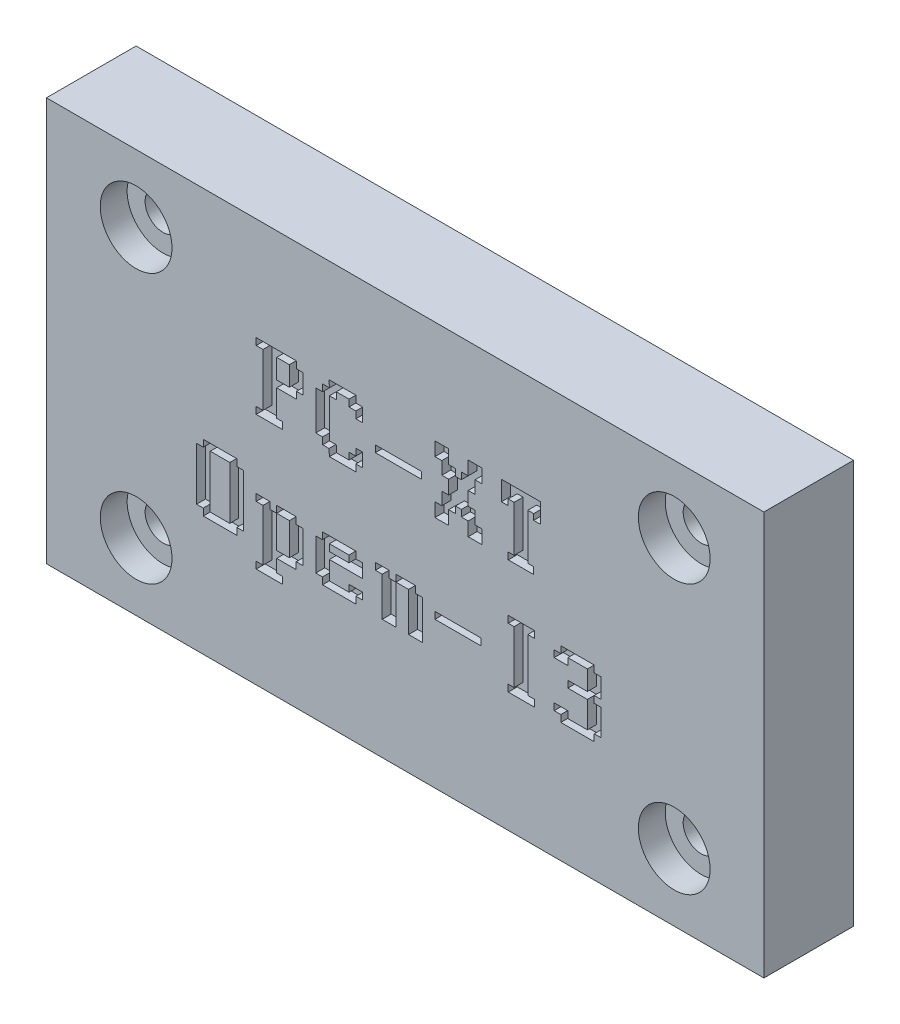
from build123d import *

# Parameters (mm, degrees)
SKETCH1_W                = 80
SKETCH1_H                = 45
BOSS_EXTRUDE1_DEPTH      = 10
SKETCH2_W                = 7.8
SKETCH2_H                = 12
CUT_EXTRUDE1_DEPTH       = 77
SKETCH3_R                = 2
CUT_EXTRUDE2_DEPTH       = 93.330926563
SKETCH4_R                = 4
CUT_EXTRUDE4_DEPTH       = 3
CUT_EXTRUDE5_START       = -1
CUT_EXTRUDE5_OUTLINE_W   = 1.41629902
CUT_EXTRUDE5_OUTLINE_H   = 2.178921569
CUT_EXTRUDE5_OUTLINE_W_2 = 2.178921569
CUT_EXTRUDE5_OUTLINE_H_2 = 5.883088235
CUT_EXTRUDE5_OUTLINE_W_3 = 5.147702206
CUT_EXTRUDE5_OUTLINE_H_3 = 0.762622549
CUT_EXTRUDE5_OUTLINE_W_4 = 2.178921568
CUT_EXTRUDE5_DEPTH       = 1


# Read off the part's stored shape, not the designer's step: Cut-Extrude5
with BuildPart() as part:
    # Sketch1 → Boss-Extrude1 (new body)
    with BuildSketch(Plane.XY):
        with Locations((40, 22.5)):
            Rectangle(SKETCH1_W, SKETCH1_H)
    extrude(amount=BOSS_EXTRUDE1_DEPTH)

    # Sketch2 → Cut-Extrude1 (cut)
    with BuildSketch(Plane.ZY):
        with Locations((3.9, 22.5)):
            Rectangle(SKETCH2_W, SKETCH2_H)
    extrude(amount=-CUT_EXTRUDE1_DEPTH, mode=Mode.SUBTRACT)

    # Sketch3 → Cut-Extrude2 (cut, through all)
    with BuildSketch(Plane.XY.offset(10)):
        with Locations((10, 37.5)):
            Circle(SKETCH3_R)
        with Locations((70, 37.5)):
            Circle(SKETCH3_R)
        with Locations((70, 7.5)):
            Circle(SKETCH3_R)
        with Locations((10, 7.5)):
            Circle(SKETCH3_R)
    extrude(amount=-CUT_EXTRUDE2_DEPTH, mode=Mode.SUBTRACT)

    # Sketch4 → Cut-Extrude4 (cut)
    with BuildSketch(Plane.XY.offset(10)):
        with Locations((10, 37.5)):
            Circle(SKETCH4_R)
        with Locations((70, 37.5)):
            Circle(SKETCH4_R)
        with Locations((70, 7.5)):
            Circle(SKETCH4_R)
        with Locations((10, 7.5)):
            Circle(SKETCH4_R)
    extrude(amount=-CUT_EXTRUDE4_DEPTH, mode=Mode.SUBTRACT)

    # Cut-Extrude5 outline → Cut-Extrude5 (cut)
    # profile 1 of 13: a face of its own
    with BuildSketch(Plane.XY.offset(10).offset(CUT_EXTRUDE5_START)):
        Polygon((25.673590686, 26.886952343), (25.673590686, 29.828496461), (27.879748775, 29.828496461), (27.879748775, 30.59111901), (28.615134804, 30.59111901), (28.615134804, 32.770040579), (27.867832797, 32.770040579), (27.867832797, 33.532663128), (23.385723039, 33.532663128), (23.385723039, 32.770040579), (24.148345588, 32.770040579), (24.148345588, 26.886952343), (23.385723039, 26.886952343), (23.385723039, 26.124329794), (26.327267157, 26.124329794), (26.327267157, 26.886952343), align=None)
        with Locations((26.381740196, 31.680579795)):
            Rectangle(CUT_EXTRUDE5_OUTLINE_W, CUT_EXTRUDE5_OUTLINE_H, mode=Mode.SUBTRACT)
    # profile 2 of 13: a face of its own
    with BuildSketch(Plane.XY.offset(10).offset(CUT_EXTRUDE5_START)):
        Polygon((25.673590686, 11.941854304), (25.673590686, 13.358153324), (27.852512255, 13.358153324), (27.852512255, 14.120775873), (28.615134804, 14.120775873), (28.615134804, 17.715996461), (27.852512255, 17.715996461), (27.852512255, 18.47861901), (25.673590686, 18.47861901), (25.673590686, 17.715996461), (27.089889706, 17.715996461), (27.089889706, 14.120775873), (25.673590686, 14.120775873), (25.673590686, 17.710889614), (25.668483839, 17.715996461), (24.910968137, 17.715996461), (24.910968137, 18.47861901), (23.385723039, 18.47861901), (23.385723039, 17.715996461), (24.148345588, 17.715996461), (24.148345588, 11.941854304), (23.385723039, 11.941854304), (23.385723039, 11.179231755), (26.327267157, 11.179231755), (26.327267157, 11.941854304), align=None)
    # profile 3 of 13: a face of its own
    with BuildSketch(Plane.XY.offset(10).offset(CUT_EXTRUDE5_START)):
        Polygon((52.147487745, 26.886952343), (51.493811275, 26.886952343), (51.493811275, 26.124329794), (54.326409314, 26.124329794), (54.326409314, 26.886952343), (53.672732843, 26.886952343), (53.672732843, 32.00741803), (54.326409314, 32.00741803), (54.326409314, 31.353741559), (55.089031863, 31.353741559), (55.089031863, 33.532663128), (50.731188725, 33.532663128), (50.731188725, 31.353741559), (51.493811275, 31.353741559), (51.493811275, 32.00741803), (52.147487745, 32.00741803), align=None)
    # profile 4 of 13: a face of its own
    with BuildSketch(Plane.XY.offset(10).offset(CUT_EXTRUDE5_START)):
        Polygon((33.73560049, 26.886952343), (32.319301471, 26.886952343), (32.319301471, 27.649574892), (31.556678922, 27.649574892), (31.556678922, 32.00741803), (32.319301471, 32.00741803), (32.319301471, 32.770040579), (33.73560049, 32.770040579), (33.73560049, 32.00741803), (34.498223039, 32.00741803), (34.498223039, 31.244795481), (35.260845588, 31.244795481), (35.260845588, 32.770040579), (34.498223039, 32.770040579), (34.498223039, 33.532663128), (31.502205882, 33.532663128), (31.556678922, 32.770040579), (30.794056373, 32.770040579), (30.794056373, 32.00741803), (30.031433824, 32.00741803), (30.031433824, 27.649574892), (30.794056373, 27.649574892), (30.794056373, 26.886952343), (31.502205882, 26.886952343), (31.556678922, 26.124329794), (34.498223039, 26.124329794), (34.498223039, 26.886952343), (35.260845588, 26.886952343), (35.260845588, 28.412197441), (34.498223039, 28.412197441), (34.498223039, 27.649574892), (33.73560049, 27.649574892), align=None)
    # profile 5 of 13: a face of its own
    with BuildSketch(Plane.XY.offset(10).offset(CUT_EXTRUDE5_START)):
        Polygon((47.027022059, 26.124329794), (48.552267157, 26.124329794), (48.552267157, 27.649574892), (47.789644608, 27.649574892), (47.789644608, 29.065873912), (47.027022059, 29.065873912), (47.027022059, 30.59111901), (47.789644608, 30.59111901), (47.789644608, 32.00741803), (48.552267157, 32.00741803), (48.552267157, 33.532663128), (47.027022059, 33.532663128), (47.027022059, 32.00741803), (46.26439951, 32.00741803), (46.26439951, 31.244795481), (45.610723039, 31.244795481), (45.610723039, 32.00741803), (44.84810049, 32.00741803), (44.84810049, 33.532663128), (43.322855392, 33.532663128), (43.322855392, 32.00741803), (44.085477941, 32.00741803), (44.085477941, 30.59111901), (44.84810049, 30.59111901), (44.84810049, 29.065873912), (44.085477941, 29.065873912), (44.085477941, 27.649574892), (43.322855392, 27.649574892), (43.322855392, 26.124329794), (44.84810049, 26.124329794), (44.84810049, 27.649574892), (45.610723039, 27.649574892), (45.610723039, 28.384960922), (46.26439951, 28.384960922), (46.26439951, 27.649574892), (47.027022059, 27.649574892), align=None)
    # profile 6 of 13: a face of its own
    with BuildSketch(Plane.XY.offset(10).offset(CUT_EXTRUDE5_START)):
        Polygon((58.139522059, 17.82494254), (58.139522059, 17.06231999), (60.318443627, 17.06231999), (60.318443627, 14.120775873), (58.139522059, 14.120775873), (58.139522059, 14.883398422), (56.614276961, 14.883398422), (56.614276961, 14.120775873), (57.358174403, 14.120775873), (57.358174403, 13.358153324), (61.081066176, 13.358153324), (61.081066176, 14.120775873), (61.843688725, 14.120775873), (61.843688725, 17.06231999), (61.081066176, 17.06231999), (61.081066176, 17.82494254), (61.843688725, 17.82494254), (61.843688725, 20.003864108), (61.081066176, 20.003864108), (61.081066176, 20.766486657), (57.358174403, 20.766486657), (57.358174403, 20.003864108), (56.614276961, 20.003864108), (56.614276961, 19.241241559), (58.139522059, 19.241241559), (58.139522059, 20.003864108), (60.318443627, 20.003864108), (60.318443627, 17.82494254), align=None)
    # profile 7 of 13: a face of its own
    with BuildSketch(Plane.XY.offset(10).offset(CUT_EXTRUDE5_START)):
        Polygon((53.672732843, 20.003864108), (54.435355392, 20.003864108), (54.435355392, 20.766486657), (51.493811275, 20.766486657), (51.493811275, 20.003864108), (52.147487745, 20.003864108), (52.147487745, 14.120775873), (51.493811275, 14.120775873), (51.493811275, 13.358153324), (54.435355392, 13.358153324), (54.435355392, 14.120775873), (53.672732843, 14.120775873), align=None)
    # profile 8 of 13: a face of its own
    with BuildSketch(Plane.XY.offset(10).offset(CUT_EXTRUDE5_START)):
        Polygon((17.487314262, 20.003864108), (16.740012255, 20.003864108), (16.740012255, 14.120775873), (17.487314262, 14.120775873), (17.487314262, 13.358153324), (21.222122013, 13.358153324), (21.222122013, 14.120775873), (21.96942402, 14.120775873), (21.96942402, 20.003864108), (21.222122013, 20.003864108), (21.222122013, 20.766486657), (17.487314262, 20.766486657), align=None)
        with Locations((19.354718138, 17.062319991)):
            Rectangle(CUT_EXTRUDE5_OUTLINE_W_2, CUT_EXTRUDE5_OUTLINE_H_2, mode=Mode.SUBTRACT)
    # profile 9 of 13: a face of its own
    with BuildSketch(Plane.XY.offset(10).offset(CUT_EXTRUDE5_START)):
        with Locations((45.896706495, 16.681008715)):
            Rectangle(CUT_EXTRUDE5_OUTLINE_W_3, CUT_EXTRUDE5_OUTLINE_H_3)
    # profile 10 of 13: a face of its own
    with BuildSketch(Plane.XY.offset(10).offset(CUT_EXTRUDE5_START)):
        Polygon((34.513543581, 14.120775873), (35.260845588, 14.120775873), (35.260845588, 14.883398422), (33.73560049, 14.883398422), (33.73560049, 14.120775873), (31.556678922, 14.120775873), (31.556678922, 16.190751363), (35.260845588, 16.190751363), (35.260845588, 17.715996461), (34.513543581, 17.715996461), (34.513543581, 18.47861901), (30.77873583, 18.47861901), (30.77873583, 17.715996461), (30.031433824, 17.715996461), (30.031433824, 14.120775873), (30.77873583, 14.120775873), (30.77873583, 13.358153324), (34.513543581, 13.358153324), align=None)
        with Locations((32.646139706, 17.334685186)):
            Rectangle(CUT_EXTRUDE5_OUTLINE_W_4, CUT_EXTRUDE5_OUTLINE_H_3, mode=Mode.SUBTRACT)
    # profile 11 of 13: a face of its own
    with BuildSketch(Plane.XY.offset(10).offset(CUT_EXTRUDE5_START)):
        Polygon((40.381311275, 13.358153324), (41.906556373, 13.358153324), (41.906556373, 17.715996461), (41.171170343, 17.715996461), (41.171170343, 18.47861901), (38.965012255, 18.47861901), (38.975012255, 17.715996461), (40.381311275, 17.715996461), align=None)
    # profile 12 of 13: a face of its own
    with BuildSketch(Plane.XY.offset(10).offset(CUT_EXTRUDE5_START)):
        Polygon((37.439767157, 13.358153324), (38.965012255, 13.358153324), (38.965012255, 17.715996461), (38.202389706, 17.715996461), (38.202389706, 18.47861901), (36.677144608, 18.47861901), (36.677144608, 17.715996461), (37.439767157, 17.715996461), align=None)
    # profile 13 of 13: a face of its own
    with BuildSketch(Plane.XY.offset(10).offset(CUT_EXTRUDE5_START)):
        with Locations((39.250995711, 29.447185187)):
            Rectangle(CUT_EXTRUDE5_OUTLINE_W_3, CUT_EXTRUDE5_OUTLINE_H_3)
    extrude(amount=CUT_EXTRUDE5_DEPTH, mode=Mode.SUBTRACT)


solid = part.part
